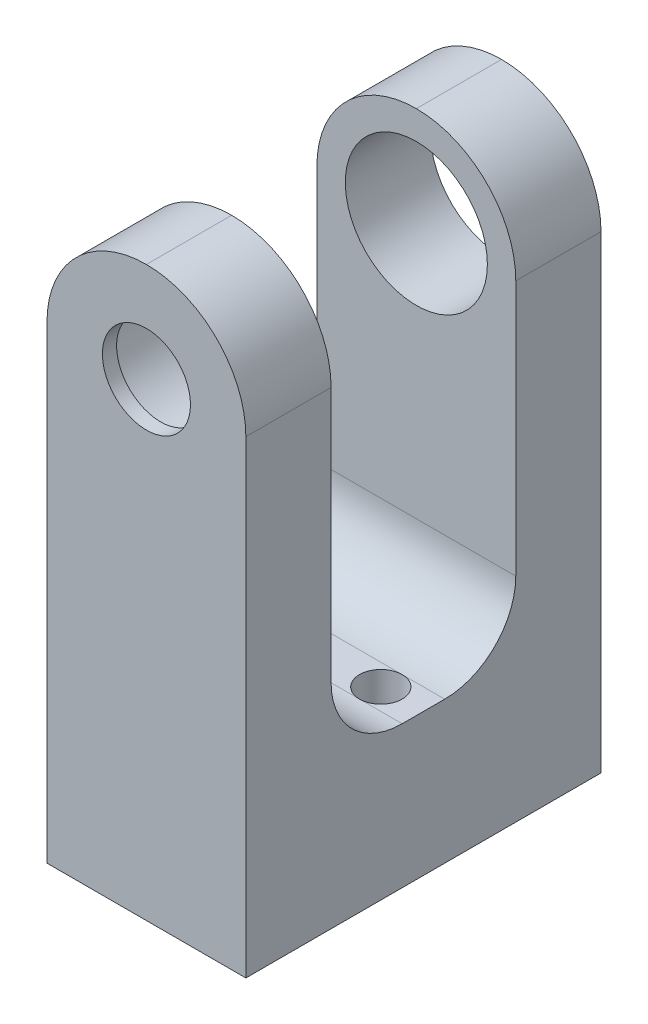
from build123d import *

# Parameters (mm, degrees)
EXTRUDE_1_DEPTH     = 14
FILLET_1_R          = 7
CUT_EXTRUDE_START   = -1
SKETCH_7_R          = 5
CUT_EXTRUDE_1_DEPTH = 31
SKETCH_8_R          = 3.1
CUT_EXTRUDE_2_DEPTH = 35
SKETCH_10_R         = 1.5
CUT_EXTRUDE_3_DEPTH = 20


with BuildPart() as part:
    # 草图4 → 凸台-拉伸1 (new body)
    with BuildSketch(Plane(origin=(0, 0, 0), x_dir=(0, 0, -1), z_dir=(1, 0, 0))):
        with BuildLine():
            Line((0, 0), (12.5, 0))
            Line((12.5, 0), (12.5, 40))
            Line((12.5, 40), (6.5, 40))
            Line((6.5, 40), (6.5, 15))
            ThreePointArc((6.5, 15), (5.035533906, 11.464466094), (1.5, 10))
            Line((1.5, 10), (-1.5, 10))
            ThreePointArc((-1.5, 10), (-5.035533906, 11.464466094), (-6.5, 15))
            Line((-6.5, 15), (-6.5, 40))
            Line((-6.5, 40), (-12.5, 40))
            Line((-12.5, 40), (-12.5, 0))
            Line((-12.5, 0), (0, 0))
        make_face()
    extrude(amount=EXTRUDE_1_DEPTH)

    # 圆角1
    fillet_1_edges = [part.edges().sort_by_distance(p)[0] for p in [
        (0, 40, 9.5),
        (0, 40, -9.5),
        (14, 40, -9.5),
        (14, 40, 9.5),
    ]]
    fillet(fillet_1_edges, radius=FILLET_1_R - 0.0001)  # a hair under: the kernel refuses the full size

    # 草图7 → 切除-拉伸1 (cut)
    with BuildSketch(Plane.XY.offset(12.5).offset(CUT_EXTRUDE_START)):
        with Locations((7, 33)):
            Circle(SKETCH_7_R)
    extrude(amount=-CUT_EXTRUDE_1_DEPTH, mode=Mode.SUBTRACT)

    # 草图8 → 切除-拉伸2 (cut)
    with BuildSketch(Plane.XY.offset(12.5)):
        with Locations((7, 33)):
            Circle(SKETCH_8_R)
    extrude(amount=-CUT_EXTRUDE_2_DEPTH, mode=Mode.SUBTRACT)

    # 草图10 → 切除-拉伸3 (cut)
    with BuildSketch(Plane(origin=(0, 10, 0), x_dir=(1, 0, 0), z_dir=(0, 1, 0))):
        with Locations(Location((3, 0, 0), (0, 0, 270))):
            Circle(SKETCH_10_R)
        with Locations(Location((11, 0, 0), (0, 0, 270))):
            Circle(SKETCH_10_R)
    extrude(amount=-CUT_EXTRUDE_3_DEPTH, mode=Mode.SUBTRACT)


solid = part.part
